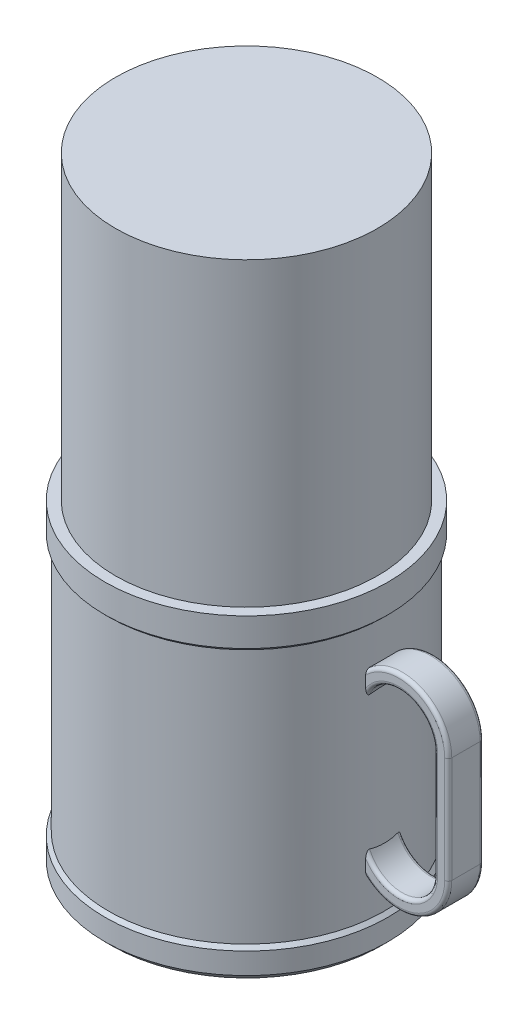
from build123d import *

# Parameters (mm, degrees)
SKETCH1_R               = 39
BOSS_EXTRUDE1_DEPTH     = 90
SHELL3_T                = -3
BOSS_EXTRUDE3_START     = -8
SKETCH6_R               = 40
SKETCH6_R_2             = 39
BOSS_EXTRUDE3_DEPTH     = 8
CHAMFER2_SIZE           = 2
CHAMFER3_SIZE           = 1
CHAMFER4_SIZE           = 1
BOSS_EXTRUDE8_START     = 30
BOSS_EXTRUDE8_OUTLINE_W = 4
BOSS_EXTRUDE8_OUTLINE_H = 10
BOSS_EXTRUDE8_DEPTH     = 29.9999999
BOSS_EXTRUDE8_START_2   = -5
BOSS_EXTRUDE8_2_DEPTH   = 10
CUT_EXTRUDE3_START      = -70
SKETCH11_R              = 36
CUT_EXTRUDE3_DEPTH      = 70
FILLET4_R               = 1
FILLET5_R               = 1
CHAMFER5_SIZE           = 1
SKETCH12_R              = 37
BOSS_EXTRUDE9_DEPTH     = 85
SKETCH13_R              = 45
BOSS_EXTRUDE10_DEPTH    = 10
SKETCH14_R              = 61.590607199
SKETCH14_R_2            = 37
CUT_EXTRUDE4_DEPTH      = 25


with BuildPart() as part:
    # Sketch1 → Boss-Extrude1 (new body)
    with BuildSketch(Plane(origin=(0, 0, 0), x_dir=(1, 0, 0), z_dir=(0, 1, 0))):
        with Locations(Location((0, 0, 0), (0, 0, 90))):
            Circle(SKETCH1_R)
    extrude(amount=BOSS_EXTRUDE1_DEPTH)

    # Shell3
    shell3_openings = [part.faces().sort_by_distance(p)[0] for p in [
        (0, 90, 0),
    ]]
    offset(amount=SHELL3_T, openings=shell3_openings, kind=Kind.INTERSECTION)

    # Sketch6 → Boss-Extrude3 (add)
    with BuildSketch(Plane(origin=(0, 90, 0), x_dir=(1, 0, 0), z_dir=(0, 1, 0)).offset(BOSS_EXTRUDE3_START)):
        with Locations(Location((0, 0, 0), (0, 0, 270))):
            Circle(SKETCH6_R)
        with Locations(Location((0, 0, 0), (0, 0, 90))):
            Circle(SKETCH6_R_2, mode=Mode.SUBTRACT)
    boss_extrude3 = extrude(amount=BOSS_EXTRUDE3_DEPTH)

    # Mirror1: Boss-Extrude3 across plane
    add(boss_extrude3.mirror(Plane.ZX.offset(45)))

    # Chamfer2
    chamfer2_edges = [part.edges().sort_by_distance(p)[0] for p in [
        (0, 0, -40),
    ]]
    chamfer(chamfer2_edges, length=CHAMFER2_SIZE)

    # Chamfer3
    chamfer3_edges = [part.edges().sort_by_distance(p)[0] for p in [
        (0, 8, 39),
    ]]
    chamfer(chamfer3_edges, length=CHAMFER3_SIZE - 0.0001)  # a hair under: the kernel refuses the full size

    # Chamfer4
    chamfer4_edges = [part.edges().sort_by_distance(p)[0] for p in [
        (0, 82, 39),
    ]]
    chamfer(chamfer4_edges, length=CHAMFER4_SIZE - 0.0001)  # a hair under: the kernel refuses the full size

    # Boss-Extrude8: read off the stored shape, not the designer's step
    # Boss-Extrude8 outline → Boss-Extrude8 (add)
    with BuildSketch(Plane(origin=(0, 0, 0), x_dir=(1, 0, 0), z_dir=(0, 1, 0)).offset(BOSS_EXTRUDE8_START)):
        with BuildLine():
            Line((35.65108694, 5), (34, 5))
            Line((34, 5), (34, -5))
            Line((34, -5), (35.65108694, -5))
            ThreePointArc((35.65108694, -5), (36, 0), (35.65108694, 5))
        make_face()
        with Locations((60, 0)):
            Rectangle(BOSS_EXTRUDE8_OUTLINE_W, BOSS_EXTRUDE8_OUTLINE_H)
    extrude(amount=BOSS_EXTRUDE8_DEPTH)

    # Boss-Extrude8 2 outline → Boss-Extrude8 2 (add)
    with BuildSketch(Plane.XY.offset(BOSS_EXTRUDE8_START_2)):
        with BuildLine():
            Line((37.272505048, 30), (34, 30))
            ThreePointArc((34, 30), (34.509326065, 26.258113205), (36.000245256, 22.788489335))
            Line((36.000245256, 22.788489335), (37.093979465, 20.968545795))
            Line((37.093979465, 20.968545795), (38.678159212, 19.554748241))
            ThreePointArc((38.678159212, 19.554748241), (53.722509457, 17.222954742), (62, 30))
            Line((62, 30), (58, 30))
            ThreePointArc((58, 30), (49.841411431, 20.171001885), (38.678159212, 26.380154103))
            Line((38.678159212, 26.380154103), (37.272505048, 30))
        make_face()
        with BuildLine():
            Line((34, 60), (37.27250501, 59.9999999))
            Line((37.27250501, 59.9999999), (38.678159212, 63.619845897))
            ThreePointArc((38.678159212, 63.619845897), (49.841411431, 69.828998115), (58, 60))
            Line((58, 60), (62, 60))
            ThreePointArc((62, 60), (53.722509457, 72.777045258), (38.678159212, 70.445251759))
            Line((38.678159212, 70.445251759), (37.094524497, 69.031940618))
            Line((37.094524497, 69.031940618), (36.000980999, 67.212734781))
            ThreePointArc((36.000980999, 67.212734781), (34.509516947, 63.742574915), (34, 60))
        make_face()
    extrude(amount=BOSS_EXTRUDE8_2_DEPTH)

    # Sketch11 → Cut-Extrude3 (cut)
    with BuildSketch(Plane(origin=(0, 90, 0), x_dir=(1, 0, 0), z_dir=(0, 1, 0)).offset(CUT_EXTRUDE3_START)):
        with Locations(Location((0, 0, 0), (0, 0, 90))):
            Circle(SKETCH11_R)
    extrude(amount=CUT_EXTRUDE3_DEPTH, mode=Mode.SUBTRACT)

    # Fillet4
    fillet4_edges = [part.edges().sort_by_distance(p)[0] for p in [
        (49.841411431, 69.828998115, -5),
        (58, 44.99999995, -5),
        (53.722509457, 17.222954742, -5),
        (53.722509457, 72.777045258, -5),
        (49.841411431, 20.171001885, 5),
        (49.841411431, 69.828998115, 5),
        (53.722509457, 17.222954742, 5),
        (53.722509457, 72.777045258, 5),
        (49.841411431, 20.171001885, -5),
        (62, 44.99999995, -5),
        (58, 44.99999995, 5),
        (62, 44.99999995, 5),
    ]]
    fillet(fillet4_edges, radius=FILLET4_R)

    # Fillet5
    fillet5_edges = [part.edges().sort_by_distance(p)[0] for p in [
        (0, 3, 36),
    ]]
    fillet(fillet5_edges, radius=FILLET5_R)

    # Chamfer5
    chamfer5_edges = [part.edges().sort_by_distance(p)[0] for p in [
        (0, 90, 36),
    ]]
    chamfer(chamfer5_edges, length=CHAMFER5_SIZE)


with BuildPart() as body_2:
    # Surface-Knit1: read off the stored shape, not the designer's step
    # Surface-Knit1 outline → Surface-Knit1 (revolve)
    with BuildSketch(Plane.XY):
        with BuildLine():
            Line((0, 90), (0, 3))
            Line((0, 3), (35, 3))
            ThreePointArc((35, 3), (35.707106781, 3.292893219), (36, 4))
            Line((36, 4), (36, 89))
            Line((36, 89), (37, 90))
            Line((37, 90), (0, 90))
        make_face()
    revolve(axis=Axis((0, 0, 0), (0, 1, 0)))

    # Sketch12 → Boss-Extrude9 (add)
    with BuildSketch(Plane(origin=(0, 90, 0), x_dir=(1, 0, 0), z_dir=(0, 1, 0))):
        with Locations(Location((0, 0, 0), (0, 0, 270))):
            Circle(SKETCH12_R)
    extrude(amount=BOSS_EXTRUDE9_DEPTH)

    # Sketch13 → Boss-Extrude10 (add)
    with BuildSketch(Plane(origin=(0, 175, 0), x_dir=(1, 0, 0), z_dir=(0, 1, 0))):
        with Locations(Location((0, 0, 0), (0, 0, 270))):
            Circle(SKETCH13_R)
    extrude(amount=-BOSS_EXTRUDE10_DEPTH)

    # Sketch14 → Cut-Extrude4 (cut)
    with BuildSketch(Plane.XZ.offset(-165)):
        Circle(SKETCH14_R)
        with Locations(Location((0, 0, 0), (0, 0, 90))):
            Circle(SKETCH14_R_2, mode=Mode.SUBTRACT)
    extrude(amount=-CUT_EXTRUDE4_DEPTH, mode=Mode.SUBTRACT)


solid = Compound([part.part, body_2.part])
